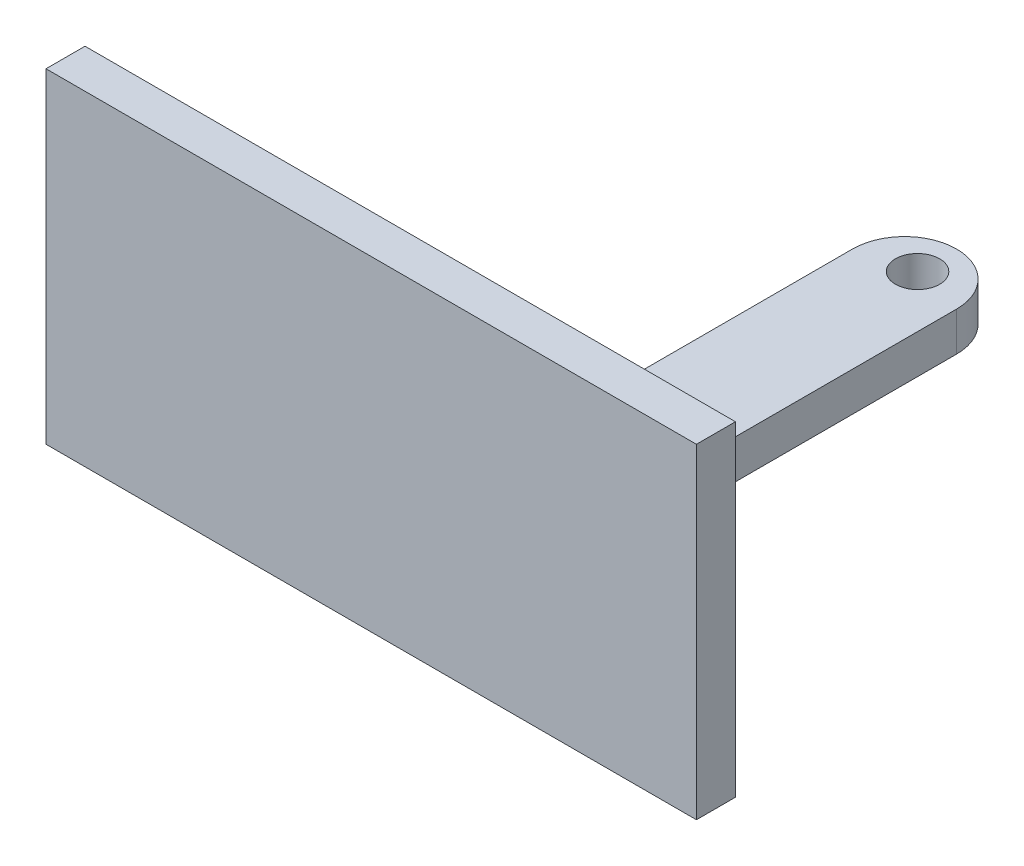
from build123d import *

# Parameters (mm, degrees)
SKETCH1_W           = 50
SKETCH1_H           = 25
BOSS_EXTRUDE1_DEPTH = 3
BOSS_EXTRUDE2_DEPTH = 42
SKETCH3_R           = 1.7
CUT_EXTRUDE1_DEPTH  = 71.774289117
FILLET2_R           = 4
FILLET3_R           = 4


with BuildPart() as part:
    # Sketch1 → Boss-Extrude1 (new body)
    with BuildSketch(Plane.XY):
        with Locations((25, -12.5)):
            Rectangle(SKETCH1_W, SKETCH1_H)
    extrude(amount=-BOSS_EXTRUDE1_DEPTH)

    # Sketch2 → Boss-Extrude2 (add)
    with BuildSketch(Plane(origin=(0, 0, -3), x_dir=(-1, 0, 0), z_dir=(0, 0, -1))):
        Polygon((-25, -25), (-29, -25), (-29, -22), (-25, -22), (-21, -22), (-21, -25), align=None)
    extrude(amount=BOSS_EXTRUDE2_DEPTH)

    # Sketch3 → Cut-Extrude1 (cut, through all)
    with BuildSketch(Plane(origin=(0, -22, 0), x_dir=(1, 0, 0), z_dir=(0, 1, 0))):
        with Locations(Location((25, 42, 0), (0, 0, 270))):
            Circle(SKETCH3_R)
        with Locations(Location((25, 15.3, 0), (0, 0, 270))):
            Circle(SKETCH3_R)
    extrude(amount=-CUT_EXTRUDE1_DEPTH, mode=Mode.SUBTRACT)

    # Fillet2
    fillet2_edges = [part.edges().sort_by_distance(p)[0] for p in [
        (29, -23.5, -45),
    ]]
    fillet(fillet2_edges, radius=FILLET2_R)

    # Fillet3
    fillet3_edges = [part.edges().sort_by_distance(p)[0] for p in [
        (21, -23.5, -45),
    ]]
    fillet(fillet3_edges, radius=FILLET3_R - 0.0001)  # a hair under: the kernel refuses the full size


solid = part.part
